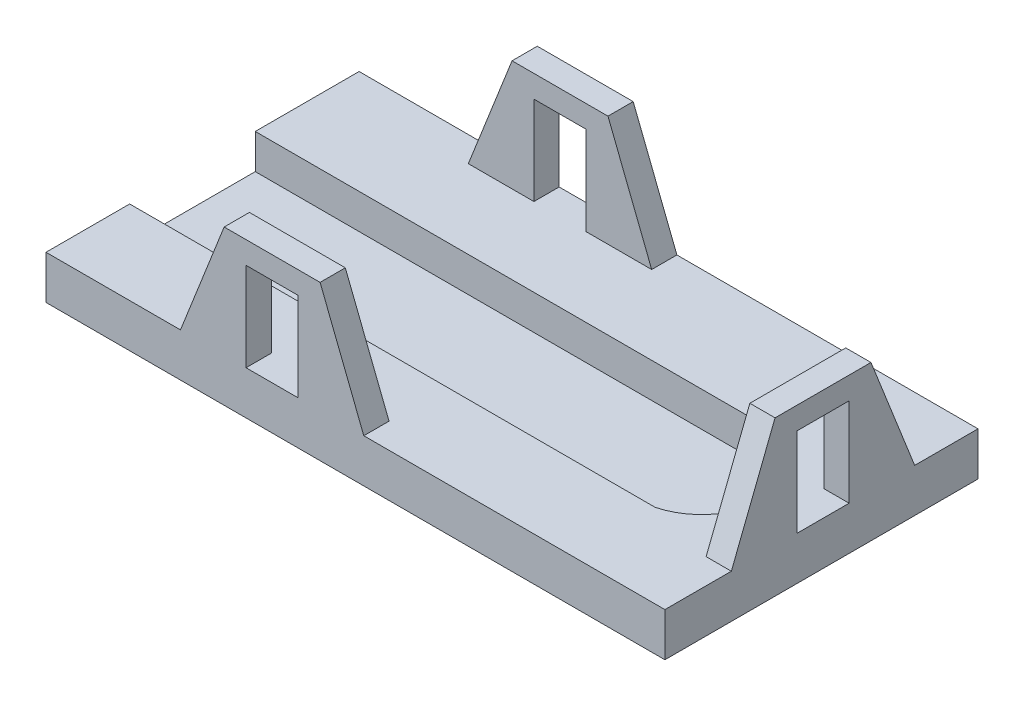
from build123d import *
from OCP.BRepFilletAPI import BRepFilletAPI_MakeChamfer

# Parameters (mm, degrees)
SKETCH1_W                  = 35.58
SKETCH1_H                  = 18
BOSS_EXTRUDE1_DEPTH        = 2.5
CUT_EXTRUDE1_DEPTH         = 2
SKETCH3_W                  = 10.54
SKETCH3_H                  = 1.45
BOSS_EXTRUDE2_DEPTH        = 6.38
CHAMFER1_SIZE              = 6.38
CHAMFER1_SIZE_2            = 2.513148834
SKETCH4_W                  = 3
SKETCH4_H                  = 5.1
CUT_EXTRUDE2_DEPTH         = 6.38
CHAMFER1_OF_MIRROR1_SIZE   = 6.38
CHAMFER1_OF_MIRROR1_SIZE_2 = 2.513148834
SKETCH14_W                 = 1.45
SKETCH14_H                 = 10.54
BOSS_EXTRUDE5_DEPTH        = 6.38
CHAMFER4_SIZE              = 6.38
CHAMFER4_SIZE_2            = 2.513148834
SKETCH15_W                 = 3
SKETCH15_H                 = 5.1
CUT_EXTRUDE4_DEPTH         = 6.38


with BuildPart() as part:
    # Sketch1 → Boss-Extrude1 (new body)
    with BuildSketch(Plane(origin=(0, 0, 0), x_dir=(1, 0, 0), z_dir=(0, 1, 0))):
        with Locations((17.79, 9)):
            Rectangle(SKETCH1_W, SKETCH1_H)
    extrude(amount=BOSS_EXTRUDE1_DEPTH)

    # Sketch2 → Cut-Extrude1 (cut)
    with BuildSketch(Plane(origin=(0, 2.5, 0), x_dir=(1, 0, 0), z_dir=(0, 1, 0))):
        with BuildLine():
            Line((0, 12.03), (30.203676308, 12.03))
            ThreePointArc((30.203676308, 12.03), (33, 8.42), (30.203676308, 4.81))
            Line((30.203676308, 4.81), (0, 4.81))
            Line((0, 4.81), (0, 12.03))
        make_face()
    extrude(amount=-CUT_EXTRUDE1_DEPTH, mode=Mode.SUBTRACT)

    # Sketch3 → Boss-Extrude2 (add)
    with BuildSketch(Plane(origin=(0, 2.5, 0), x_dir=(1, 0, 0), z_dir=(0, 1, 0))):
        with Locations((13, 17.275)):
            Rectangle(SKETCH3_W, SKETCH3_H)
    boss_extrude2 = extrude(amount=BOSS_EXTRUDE2_DEPTH)

    # Chamfer1
    chamfer1_edges_1 = [part.edges().sort_by_distance(p)[0] for p in [
        (18.27, 8.88, -17.275),
    ]]
    chamfer1_side_1 = [part.faces().sort_by_distance(p)[0] for p in [
        (18.27, 8.829737023, -17.275),
    ]]
    chamfer1_edges_2 = [part.edges().sort_by_distance(p)[0] for p in [
        (7.73, 8.88, -17.275),
    ]]
    chamfer1_side_2 = [part.faces().sort_by_distance(p)[0] for p in [
        (7.73, 8.829737023, -17.275),
    ]]
    chamfer1 = BRepFilletAPI_MakeChamfer(part.part.solid().wrapped)
    for e in chamfer1_edges_1:
        chamfer1.Add(CHAMFER1_SIZE - 0.0001, CHAMFER1_SIZE_2 - 0.0001, e.wrapped, chamfer1_side_1[0].wrapped)
    for e in chamfer1_edges_2:
        chamfer1.Add(CHAMFER1_SIZE - 0.0001, CHAMFER1_SIZE_2 - 0.0001, e.wrapped, chamfer1_side_2[0].wrapped)
    add(Compound.cast(chamfer1.Shape()), mode=Mode.REPLACE)  # a hair under: the kernel refuses the full size

    # Sketch4 → Cut-Extrude2 (cut)
    with BuildSketch(Plane.XY.offset(-16.55)):
        with Locations((13, 5.05)):
            Rectangle(SKETCH4_W, SKETCH4_H)
    cut_extrude2 = extrude(amount=-CUT_EXTRUDE2_DEPTH, mode=Mode.SUBTRACT)

    # Mirror1: Boss-Extrude2, Cut-Extrude2 across plane
    add(boss_extrude2.mirror(Plane.XY.offset(-9)))
    add(cut_extrude2.mirror(Plane.XY.offset(-9)), mode=Mode.SUBTRACT)

    # Chamfer1 of Mirror1
    chamfer1_of_mirror1_edges_1 = [part.edges().sort_by_distance(p)[0] for p in [
        (18.27, 8.88, -0.725),
    ]]
    chamfer1_of_mirror1_side_1 = [part.faces().sort_by_distance(p)[0] for p in [
        (18.27, 8.829737023, -0.725),
    ]]
    chamfer1_of_mirror1_edges_2 = [part.edges().sort_by_distance(p)[0] for p in [
        (7.73, 8.88, -0.725),
    ]]
    chamfer1_of_mirror1_side_2 = [part.faces().sort_by_distance(p)[0] for p in [
        (7.73, 8.829737023, -0.725),
    ]]
    chamfer1_of_mirror1 = BRepFilletAPI_MakeChamfer(part.part.solid().wrapped)
    for e in chamfer1_of_mirror1_edges_1:
        chamfer1_of_mirror1.Add(CHAMFER1_OF_MIRROR1_SIZE - 0.0001, CHAMFER1_OF_MIRROR1_SIZE_2 - 0.0001, e.wrapped, chamfer1_of_mirror1_side_1[0].wrapped)
    for e in chamfer1_of_mirror1_edges_2:
        chamfer1_of_mirror1.Add(CHAMFER1_OF_MIRROR1_SIZE - 0.0001, CHAMFER1_OF_MIRROR1_SIZE_2 - 0.0001, e.wrapped, chamfer1_of_mirror1_side_2[0].wrapped)
    add(Compound.cast(chamfer1_of_mirror1.Shape()), mode=Mode.REPLACE)  # a hair under: the kernel refuses the full size

    # Sketch14 → Boss-Extrude5 (add)
    with BuildSketch(Plane(origin=(0, 2.5, 0), x_dir=(1, 0, 0), z_dir=(0, 1, 0))):
        with Locations((34.855, 9.09)):
            Rectangle(SKETCH14_W, SKETCH14_H)
    extrude(amount=BOSS_EXTRUDE5_DEPTH)

    # Chamfer4
    chamfer4_edges_1 = [part.edges().sort_by_distance(p)[0] for p in [
        (34.855, 8.88, -14.36),
    ]]
    chamfer4_side_1 = [part.faces().sort_by_distance(p)[0] for p in [
        (34.855, 8.829737023, -14.36),
    ]]
    chamfer4_edges_2 = [part.edges().sort_by_distance(p)[0] for p in [
        (34.855, 8.88, -3.82),
    ]]
    chamfer4_side_2 = [part.faces().sort_by_distance(p)[0] for p in [
        (34.855, 8.829737023, -3.82),
    ]]
    chamfer4 = BRepFilletAPI_MakeChamfer(part.part.solid().wrapped)
    for e in chamfer4_edges_1:
        chamfer4.Add(CHAMFER4_SIZE - 0.0001, CHAMFER4_SIZE_2 - 0.0001, e.wrapped, chamfer4_side_1[0].wrapped)
    for e in chamfer4_edges_2:
        chamfer4.Add(CHAMFER4_SIZE - 0.0001, CHAMFER4_SIZE_2 - 0.0001, e.wrapped, chamfer4_side_2[0].wrapped)
    add(Compound.cast(chamfer4.Shape()), mode=Mode.REPLACE)  # a hair under: the kernel refuses the full size

    # Sketch15 → Cut-Extrude4 (cut)
    with BuildSketch(Plane.ZY.offset(-34.13)):
        with Locations((-9.09, 5.05)):
            Rectangle(SKETCH15_W, SKETCH15_H)
    extrude(amount=-CUT_EXTRUDE4_DEPTH, mode=Mode.SUBTRACT)


solid = part.part
